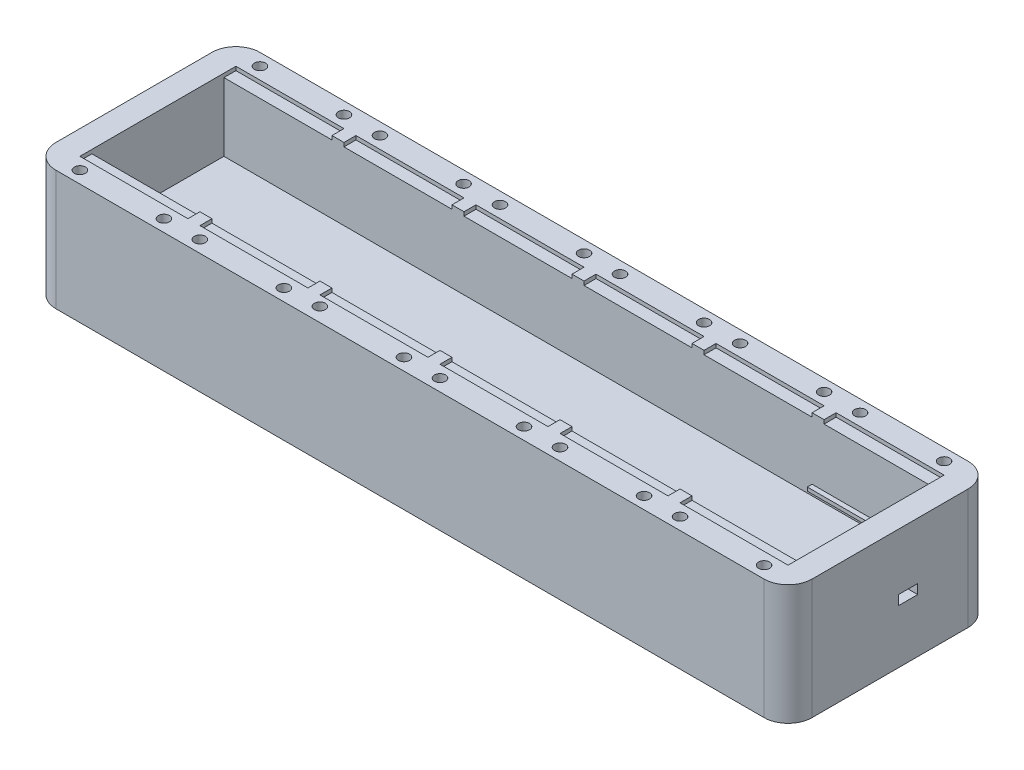
from build123d import *

# Parameters (mm, degrees)
SKIZZE2_W                       = 315
SKIZZE2_H                       = 50
AUFSATZ_LINEAR_AUSTRAGEN1_DEPTH = 85
SKIZZE4_W                       = 295
SKIZZE4_H                       = 55
SCHNITT_LINEAR_AUSTRAGEN1_DEPTH = 30
VERRUNDUNG1_R                   = 10
VERRUNDUNG2_R                   = 10
VERRUNDUNG3_R                   = 10
VERRUNDUNG4_R                   = 10
SKIZZE11_W                      = 45
SKIZZE11_H                      = 5
SKIZZE11_H_2                    = 5.008661904
SCHNITT_LINEAR_AUSTRAGEN4_DEPTH = 1.6
SKIZZE13_W                      = 295
SKIZZE13_H                      = 3
AUFSATZ_LINEAR_AUSTRAGEN2_DEPTH = 4.2
SKIZZE14_W                      = 8
SKIZZE14_H                      = 4
SCHNITT_LINEAR_AUSTRAGEN5_DEPTH = 19
SKIZZE15_W                      = 50
SKIZZE15_H                      = 1.5
AUFSATZ_LINEAR_AUSTRAGEN3_DEPTH = 2
SKIZZE16_W                      = 50
SKIZZE16_H                      = 1.5
AUFSATZ_LINEAR_AUSTRAGEN4_DEPTH = 2
SKIZZE17_R                      = 2.3
SCHNITT_LINEAR_AUSTRAGEN6_DEPTH = 4


with BuildPart() as part:
    # Skizze2 → Aufsatz-Linear austragen1 (new body)
    with BuildSketch(Plane.XY):
        with Locations((157.5, 25)):
            Rectangle(SKIZZE2_W, SKIZZE2_H)
    extrude(amount=AUFSATZ_LINEAR_AUSTRAGEN1_DEPTH)

    # Skizze4 → Schnitt-Linear austragen1 (cut)
    with BuildSketch(Plane(origin=(0, 50, 0), x_dir=(1, 0, 0), z_dir=(0, 1, 0))):
        with Locations((157.5, -42.5)):
            Rectangle(SKIZZE4_W, SKIZZE4_H)
    extrude(amount=-SCHNITT_LINEAR_AUSTRAGEN1_DEPTH, mode=Mode.SUBTRACT)

    # Verrundung1
    verrundung1_edges = [part.edges().sort_by_distance(p)[0] for p in [
        (315, 25, 0),
    ]]
    fillet(verrundung1_edges, radius=VERRUNDUNG1_R)

    # Verrundung2
    verrundung2_edges = [part.edges().sort_by_distance(p)[0] for p in [
        (315, 25, 85),
    ]]
    fillet(verrundung2_edges, radius=VERRUNDUNG2_R)

    # Verrundung3
    verrundung3_edges = [part.edges().sort_by_distance(p)[0] for p in [
        (0, 25, 85),
    ]]
    fillet(verrundung3_edges, radius=VERRUNDUNG3_R)

    # Verrundung4
    verrundung4_edges = [part.edges().sort_by_distance(p)[0] for p in [
        (0, 25, 0),
    ]]
    fillet(verrundung4_edges, radius=VERRUNDUNG4_R)

    # Skizze11 → Schnitt-Linear austragen4 (cut)
    with BuildSketch(Plane(origin=(0, 50, 0), x_dir=(1, 0, 0), z_dir=(0, 1, 0))):
        with Locations((32.5, -12.5)):
            Rectangle(SKIZZE11_W, SKIZZE11_H)
        with Locations((32.5, -72.5)):
            Rectangle(SKIZZE11_W, SKIZZE11_H)
        with Locations((82.5, -72.5)):
            Rectangle(SKIZZE11_W, SKIZZE11_H)
        with Locations((132.5, -72.504330952)):
            Rectangle(SKIZZE11_W, SKIZZE11_H_2)
        with Locations((182.5, -72.504330952)):
            Rectangle(SKIZZE11_W, SKIZZE11_H_2)
        with Locations((232.5, -72.5)):
            Rectangle(SKIZZE11_W, SKIZZE11_H)
        with Locations((282.5, -72.5)):
            Rectangle(SKIZZE11_W, SKIZZE11_H)
        with Locations((282.5, -12.5)):
            Rectangle(SKIZZE11_W, SKIZZE11_H)
        with Locations((232.5, -12.5)):
            Rectangle(SKIZZE11_W, SKIZZE11_H)
        with Locations((182.5, -12.5)):
            Rectangle(SKIZZE11_W, SKIZZE11_H)
        with Locations((132.5, -12.5)):
            Rectangle(SKIZZE11_W, SKIZZE11_H)
        with Locations((82.5, -12.5)):
            Rectangle(SKIZZE11_W, SKIZZE11_H)
    extrude(amount=-SCHNITT_LINEAR_AUSTRAGEN4_DEPTH, mode=Mode.SUBTRACT)

    # Skizze13 → Aufsatz-Linear austragen2 (add)
    with BuildSketch(Plane(origin=(0, 20, 0), x_dir=(1, 0, 0), z_dir=(0, 1, 0))):
        with Locations((157.5, -68.5)):
            Rectangle(SKIZZE13_W, SKIZZE13_H)
    extrude(amount=AUFSATZ_LINEAR_AUSTRAGEN2_DEPTH)

    # Skizze14 → Schnitt-Linear austragen5 (cut)
    with BuildSketch(Plane.ZY.offset(-305)):
        with Locations((35, 24.4)):
            Rectangle(SKIZZE14_W, SKIZZE14_H)
    extrude(amount=-SCHNITT_LINEAR_AUSTRAGEN5_DEPTH, mode=Mode.SUBTRACT)

    # Skizze15 → Aufsatz-Linear austragen3 (add)
    with BuildSketch(Plane.XY.offset(15)):
        with Locations((280, 23.45)):
            Rectangle(SKIZZE15_W, SKIZZE15_H)
    extrude(amount=AUFSATZ_LINEAR_AUSTRAGEN3_DEPTH)

    # Skizze16 → Aufsatz-Linear austragen4 (add)
    with BuildSketch(Plane(origin=(0, 0, 67), x_dir=(-1, 0, 0), z_dir=(0, 0, -1))):
        with Locations((-280, 23.45)):
            Rectangle(SKIZZE16_W, SKIZZE16_H)
    extrude(amount=AUFSATZ_LINEAR_AUSTRAGEN4_DEPTH)

    # Skizze17 → Schnitt-Linear austragen6 (cut)
    with BuildSketch(Plane(origin=(0, 50, 0), x_dir=(1, 0, 0), z_dir=(0, 1, 0))):
        with Locations((50, -80)):
            Circle(SKIZZE17_R)
        with Locations((15, -80)):
            Circle(SKIZZE17_R)
        with Locations((15, -5)):
            Circle(SKIZZE17_R)
        with Locations((50, -5)):
            Circle(SKIZZE17_R)
        with Locations((65, -5)):
            Circle(SKIZZE17_R)
        with Locations((99.834927097, -5)):
            Circle(SKIZZE17_R)
        with Locations((65, -80)):
            Circle(SKIZZE17_R)
        with Locations((100, -80)):
            Circle(SKIZZE17_R)
        with Locations((114.145512134, -79.164010762)):
            Circle(SKIZZE17_R)
        with Locations((150, -80)):
            Circle(SKIZZE17_R)
        with Locations((165, -80)):
            Circle(SKIZZE17_R)
        with Locations((200, -80)):
            Circle(SKIZZE17_R)
        with Locations((215, -80)):
            Circle(SKIZZE17_R)
        with Locations((250, -80)):
            Circle(SKIZZE17_R)
        with Locations((265, -80)):
            Circle(SKIZZE17_R)
        with Locations((300, -80)):
            Circle(SKIZZE17_R)
        with Locations((300, -5)):
            Circle(SKIZZE17_R)
        with Locations((265, -5)):
            Circle(SKIZZE17_R)
        with Locations((250, -5)):
            Circle(SKIZZE17_R)
        with Locations((215, -5)):
            Circle(SKIZZE17_R)
        with Locations((200, -5)):
            Circle(SKIZZE17_R)
        with Locations((165, -5)):
            Circle(SKIZZE17_R)
        with Locations((150, -5)):
            Circle(SKIZZE17_R)
        with Locations((115, -5)):
            Circle(SKIZZE17_R)
    extrude(amount=-SCHNITT_LINEAR_AUSTRAGEN6_DEPTH, mode=Mode.SUBTRACT)


solid = part.part
